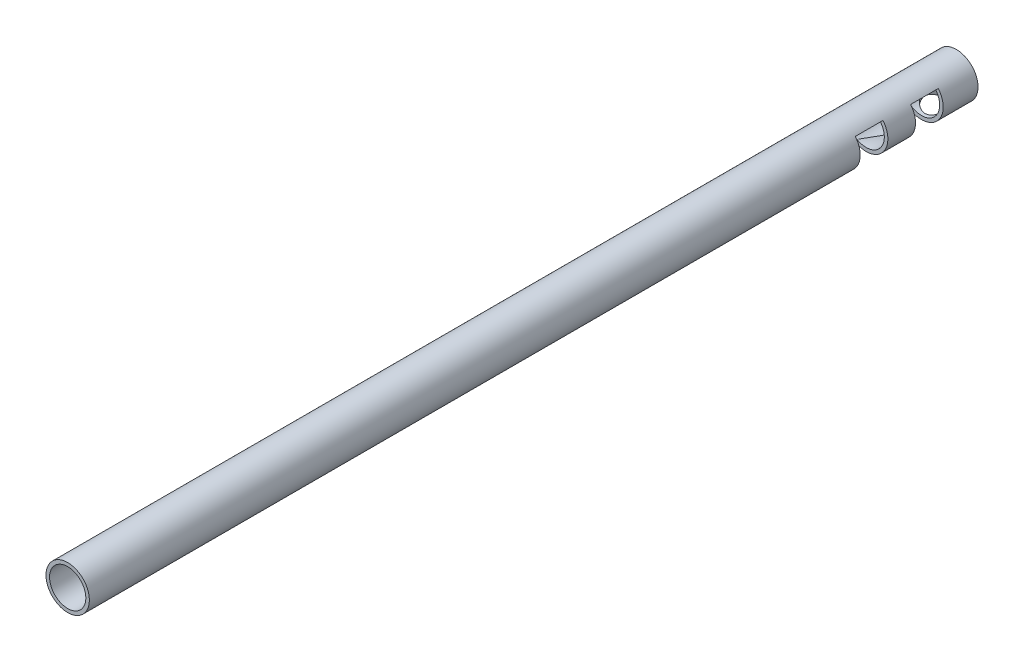
from build123d import *
from build123d.topology import SkipClean

# Parameters (mm, degrees)
THICKEN1_START     = 3.38125
THICKEN1_DEPTH     = 22.11875
THICKEN1_2_DEPTH   = 1
THICKEN1_START_2   = 1.79375
THICKEN1_3_DEPTH   = 0.79375
THICKEN1_START_3   = 1
THICKEN1_4_DEPTH   = 2.38125
SKETCH7_R          = 0.396875
CUT_EXTRUDE1_DEPTH = 10


with BuildPart() as part:
    # Thicken1: read off the stored shape, not the designer's step
    # Thicken1 outline → Thicken1 (new body)
    with BuildSketch(Plane.XY.offset(THICKEN1_START)):
        with BuildLine():
            ThreePointArc((0, -0.794033341), (0.622, -0.172033341), (0, 0.449966659))
            Line((0, 0.449966659), (0, 0.348580659))
            ThreePointArc((0, 0.348580659), (0.520614, -0.172033341), (0, -0.692647341))
            Line((0, -0.692647341), (0, -0.794033341))
        make_face()
    extrude(amount=THICKEN1_DEPTH)



with BuildPart() as body_2:
    # Thicken1 2 outline → Thicken1 2 (new body)
    with BuildSketch(Plane.XY):
        with BuildLine():
            ThreePointArc((0, -0.794033341), (0.622, -0.172033341), (0, 0.449966659))
            Line((0, 0.449966659), (0, 0.348580659))
            ThreePointArc((0, 0.348580659), (0.520614, -0.172033341), (0, -0.692647341))
            Line((0, -0.692647341), (0, -0.794033341))
        make_face()
    extrude(amount=THICKEN1_2_DEPTH)


with BuildPart() as body_3:
    # Thicken1 3 outline → Thicken1 3 (new body)
    with BuildSketch(Plane.XY.offset(THICKEN1_START_2)):
        with BuildLine():
            ThreePointArc((0, -0.794033341), (0.622, -0.172033341), (0, 0.449966659))
            Line((0, 0.449966659), (0, 0.348580659))
            ThreePointArc((0, 0.348580659), (0.520614, -0.172033341), (0, -0.692647341))
            Line((0, -0.692647341), (0, -0.794033341))
        make_face()
    extrude(amount=THICKEN1_3_DEPTH)


with BuildPart() as part_1:
    add(part.part)

    add(body_2.part)  # Thicken1 4 merges body 2

    add(body_3.part)  # Thicken1 4 merges body 3
    # Thicken1 4 outline → Thicken1 4 (add)
    with BuildSketch(Plane.XY.offset(THICKEN1_START_3)):
        with BuildLine():
            Line((0.40339385, 0.157075059), (0.481952031, 0.221166659))
            ThreePointArc((0.481952031, 0.221166659), (0.26675232, 0.389862735), (0, 0.449966659))
            Line((0, 0.449966659), (0, 0.348580659))
            ThreePointArc((0, 0.348580659), (0.223271692, 0.298273674), (0.40339385, 0.157075059))
        make_face()
    extrude(amount=THICKEN1_4_DEPTH)

    # Sketch7 → Cut-Extrude1 (cut)
    with BuildSketch(Plane(origin=(0, 0, 0), x_dir=(1, 0, 0), z_dir=(0, 1, 0))):
        with Locations((0, -0.5)):
            Circle(SKETCH7_R)
    extrude(amount=-CUT_EXTRUDE1_DEPTH, mode=Mode.SUBTRACT)

    # Mirror2: part across face


with BuildPart() as part_2:
    with SkipClean():  # the faces are left unmerged after this step: merging them gives an invalid solid
        add(part_1.part)
        add(part_1.part.mirror(Plane(origin=(0, 0.399273659, 12.75), x_dir=(0, 0, 1), z_dir=(-1, 0, 0))))


solid = part_2.part
